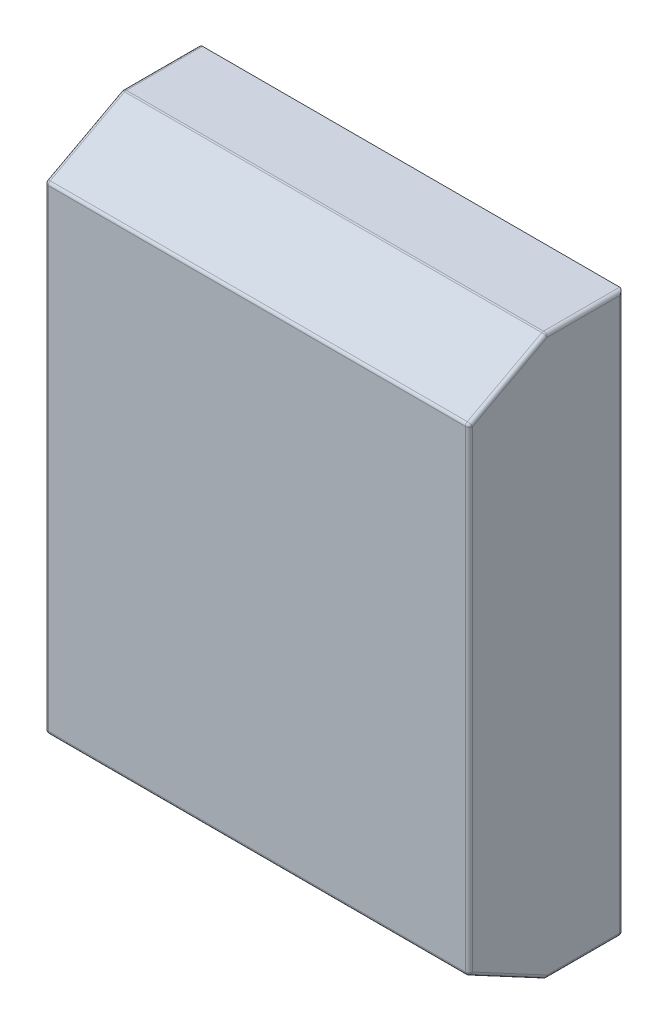
from build123d import *

# Parameters (mm, degrees)
SKETCH1_W           = 279.4
SKETCH1_H           = 368.3
BOSS_EXTRUDE1_DEPTH = 101.6
CUT_EXTRUDE2_DEPTH  = 343.662
CUT_EXTRUDE3_DEPTH  = 81.788
FILLET2_R           = 2.38


with BuildPart() as part:
    # Sketch1 → Boss-Extrude1 (new body)
    with BuildSketch(Plane.XY):
        with Locations((65.648946297, -14.210932476)):
            Rectangle(SKETCH1_W, SKETCH1_H)
    extrude(amount=BOSS_EXTRUDE1_DEPTH)

    # Sketch5 → Cut-Extrude2 (cut)
    with BuildSketch(Plane.ZY.offset(74.051053703)):
        Polygon((50.8, 169.939067524), (101.6, 142.764720342), (197.27126928, 191.743775141), (59.221541493, 225.542979991), align=None)
        Polygon((197.27126928, -220.165640093), (59.221541493, -253.964844943), (50.8, -198.360932476), (101.6, -171.186585294), align=None)
    extrude(amount=-CUT_EXTRUDE2_DEPTH, mode=Mode.SUBTRACT)

    # Sketch6 → Cut-Extrude3 (cut)
    with BuildSketch(Plane(origin=(0, -200.900932476, 0), x_dir=(-1, 0, 0), z_dir=(0, -1, 0))):
        with BuildLine():
            Line((47.465898878, -87.350896203), (-178.763791471, -87.350896203))
            ThreePointArc((-178.763791471, -87.350896203), (-188.288791471, -77.825896203), (-178.763791471, -68.300896203))
            Line((-178.763791471, -68.300896203), (47.465898878, -68.300896203))
            ThreePointArc((47.465898878, -68.300896203), (56.990898878, -77.825896203), (47.465898878, -87.350896203))
        make_face()
    extrude(amount=-CUT_EXTRUDE3_DEPTH, mode=Mode.SUBTRACT)

    # Fillet2
    fillet2_edges = [part.edges().sort_by_distance(p)[0] for p in [
        (65.648946297, -198.360932476, 0),
        (-74.051053703, -198.360932476, 25.4),
        (65.648946297, -198.360932476, 50.8),
        (205.348946297, -198.360932476, 25.4),
        (65.648946297, -171.186585294, 101.6),
        (-74.051053703, -184.773758885, 76.2),
        (205.348946297, -184.773758885, 76.2),
        (205.348946297, -14.210932476, 0),
        (-74.051053703, -14.210932476, 101.6),
        (205.348946297, -14.210932476, 101.6),
        (65.648946297, 142.764720342, 101.6),
        (205.348946297, 169.939067524, 25.4),
        (205.348946297, 156.351893933, 76.2),
        (-74.051053703, 156.351893933, 76.2),
        (-74.051053703, -14.210932476, 0),
        (65.648946297, 169.939067524, 50.8),
        (-74.051053703, 169.939067524, 25.4),
    ]]
    fillet(fillet2_edges, radius=FILLET2_R)


solid = part.part
